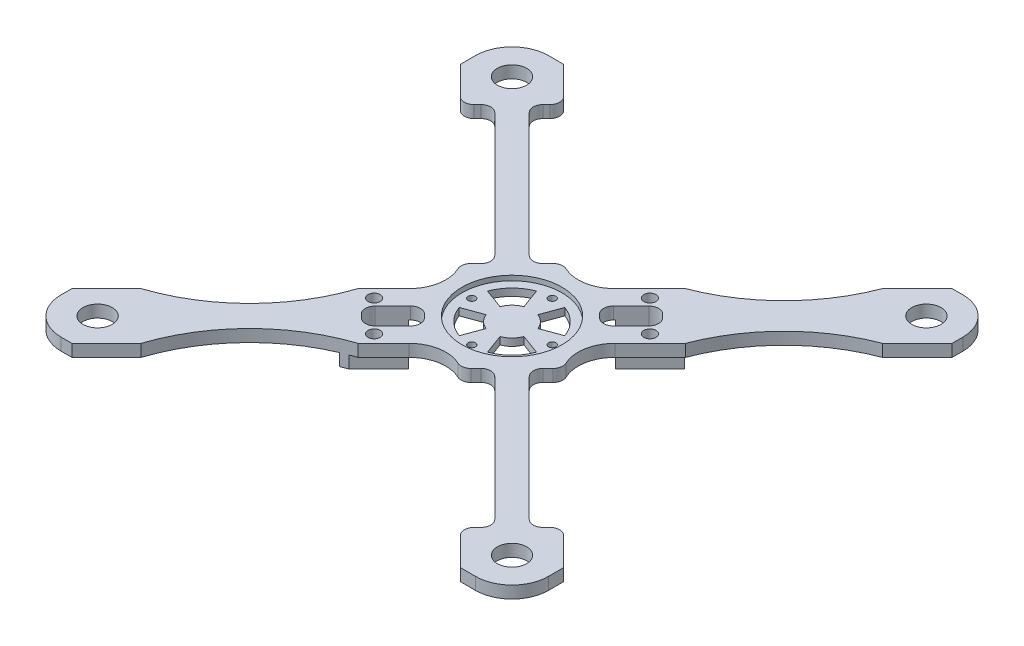
from build123d import *

# Parameters (mm, degrees)
SKETCH_1_W          = 200
SKETCH_1_H          = 200
SKETCH_1_R          = 6
EXTRUDE_1_DEPTH     = 5
SKETCH_3_R          = 20.5
CUT_EXTRUDE_1_DEPTH = 2
SKETCH_4_R          = 1.5
CUT_EXTRUDE_2_DEPTH = 142.453172464
SKETCH_6_R          = 2.5
EXTRUDE_2_DEPTH     = 5
CUT_EXTRUDE_3_DEPTH = 142.774468788
FILLET_1_R          = 15
SKETCH_7_R          = 2.5
CUT_EXTRUDE_4_DEPTH = 142.774468788
FILLET_2_R          = 4


with BuildPart() as part:
    # 草圖1 → 填料-伸長1 (new body)
    with BuildSketch(Plane(origin=(0, 0, 0), x_dir=(1, 0, 0), z_dir=(0, 1, 0))):
        Rectangle(SKETCH_1_W, SKETCH_1_H)
        with Locations(Location((85, 85, 0), (0, 0, 270))):
            Circle(SKETCH_1_R, mode=Mode.SUBTRACT)
        with Locations(Location((-85, 85, 0), (0, 0, 90))):
            Circle(SKETCH_1_R, mode=Mode.SUBTRACT)
        with Locations(Location((85, -85, 0), (0, 0, 90))):
            Circle(SKETCH_1_R, mode=Mode.SUBTRACT)
        with Locations(Location((-85, -85, 0), (0, 0, 270))):
            Circle(SKETCH_1_R, mode=Mode.SUBTRACT)
    extrude(amount=EXTRUDE_1_DEPTH)

    # 草圖3 → 除料-伸長1 (cut)
    with BuildSketch(Plane(origin=(0, 5, 0), x_dir=(1, 0, 0), z_dir=(0, 1, 0))):
        with Locations(Location((0, 0, 0), (0, 0, 270))):
            Circle(SKETCH_3_R)
    extrude(amount=-CUT_EXTRUDE_1_DEPTH, mode=Mode.SUBTRACT)

    # 草圖4 → 除料-伸長2 (cut, through all)
    with BuildSketch(Plane(origin=(0, 3, 0), x_dir=(1, 0, 0), z_dir=(0, 1, 0))):
        with Locations(Location((-16.5, 0, 0), (0, 0, 270))):
            Circle(SKETCH_4_R)
        with Locations(Location((16.5, 0, 0), (0, 0, 90))):
            Circle(SKETCH_4_R)
        with Locations(Location((0, 16.5, 0), (0, 0, 270))):
            Circle(SKETCH_4_R)
        with Locations(Location((0, -16.5, 0), (0, 0, 90))):
            Circle(SKETCH_4_R)
    extrude(amount=-CUT_EXTRUDE_2_DEPTH, mode=Mode.SUBTRACT)

    # 草圖6 → 填料-伸長2 (add)
    # profile 1 of 2: a face of its own
    with BuildSketch(Plane.XZ):
        Polygon((-44.194173824, 26.516504294), (-30.0520382, 12.374368671), (-12.374368671, 30.0520382), (-26.516504294, 44.194173824), align=None)
        with Locations(Location((-21.920310217, 34.648232278, 0), (0, 0, 270))):
            Circle(SKETCH_6_R, mode=Mode.SUBTRACT)
        with Locations(Location((-34.648232278, 21.920310217, 0), (0, 0, 90))):
            Circle(SKETCH_6_R, mode=Mode.SUBTRACT)
    # profile 2 of 2: a face of its own
    with BuildSketch(Plane.XZ):
        Polygon((26.516504294, -44.194173824), (44.194173824, -26.516504294), (30.0520382, -12.374368671), (12.374368671, -30.0520382), align=None)
        with Locations(Location((34.648232278, -21.920310217, 0), (0, 0, 90))):
            Circle(SKETCH_6_R, mode=Mode.SUBTRACT)
        with Locations(Location((21.920310217, -34.648232278, 0), (0, 0, 270))):
            Circle(SKETCH_6_R, mode=Mode.SUBTRACT)
    extrude(amount=EXTRUDE_2_DEPTH)

    # 草圖5 → 除料-伸長3 (cut, through all)
    with BuildSketch(Plane(origin=(0, 5, 0), x_dir=(1, 0, 0), z_dir=(0, 1, 0))):
        with BuildLine():
            Line((15.10230502, -22.173372832), (71.580921309, -78.651989121))
            Line((71.580921309, -78.651989121), (64.509853497, -85.723056933))
            Line((64.509853497, -85.723056933), (78.786796564, -100))
            Line((78.786796564, -100), (-80.554563517, -100))
            Line((-80.554563517, -100), (-66.36249332, -85.807929803))
            ThreePointArc((-66.36249332, -85.807929803), (-49.396614756, -58.27912998), (-21.867814933, -41.313251416))
            Line((-21.867814933, -41.313251416), (-0.883883476, -20.329319959))
            Line((-0.883883476, -20.329319959), (8.031237208, -29.244440644))
            Line((8.031237208, -29.244440644), (15.10230502, -22.173372832))
        make_face()
        with BuildLine():
            Line((-20.329319959, -0.883883476), (-29.244440644, 8.031237208))
            Line((-29.244440644, 8.031237208), (-22.173372832, 15.10230502))
            Line((-22.173372832, 15.10230502), (-78.651989121, 71.580921309))
            Line((-78.651989121, 71.580921309), (-85.723056933, 64.509853497))
            Line((-85.723056933, 64.509853497), (-100, 78.786796564))
            Line((-100, 78.786796564), (-100, -80.554563517))
            Line((-100, -80.554563517), (-85.807929803, -66.36249332))
            ThreePointArc((-85.807929803, -66.36249332), (-58.27912998, -49.396614756), (-41.313251416, -21.867814933))
            Line((-41.313251416, -21.867814933), (-20.329319959, -0.883883476))
        make_face()
        with BuildLine():
            Line((-78.786796564, 100), (80.554563517, 100))
            Line((80.554563517, 100), (66.27762045, 85.723056933))
            ThreePointArc((66.27762045, 85.723056933), (50.38135816, 61.198751144), (25.857052371, 45.302488854))
            Line((25.857052371, 45.302488854), (0.883883476, 20.329319959))
            Line((0.883883476, 20.329319959), (-8.031237208, 29.244440644))
            Line((-8.031237208, 29.244440644), (-15.10230502, 22.173372832))
            Line((-15.10230502, 22.173372832), (-71.580921309, 78.651989121))
            Line((-71.580921309, 78.651989121), (-64.509853497, 85.723056933))
            Line((-64.509853497, 85.723056933), (-78.786796564, 100))
        make_face()
        Polygon((14.425484168, 21.49655198), (27.355374186, 34.426441998), (34.426441998, 27.355374186), (21.49655198, 14.425484168), align=None)
        Polygon((-14.425484168, -21.49655198), (-27.355374186, -34.426441998), (-34.426441998, -27.355374186), (-21.49655198, -14.425484168), align=None)
        with BuildLine():
            Line((-15.866234687, 5.81423348), (-7.751406526, 2.840528218))
            ThreePointArc((-7.751406526, 2.840528218), (-5.837503906, 5.837503906), (-2.840528218, 7.751406526))
            Line((-2.840528218, 7.751406526), (-5.81423348, 15.866234687))
            ThreePointArc((-5.81423348, 15.866234687), (-11.948696877, 11.948696877), (-15.866234687, 5.81423348))
        make_face()
        with BuildLine():
            Line((15.866234687, 5.81423348), (7.751406526, 2.840528218))
            ThreePointArc((7.751406526, 2.840528218), (5.837503906, 5.837503906), (2.840528218, 7.751406526))
            Line((2.840528218, 7.751406526), (5.81423348, 15.866234687))
            ThreePointArc((5.81423348, 15.866234687), (11.948696877, 11.948696877), (15.866234687, 5.81423348))
        make_face()
        with BuildLine():
            Line((5.81423348, -15.866234687), (2.840528218, -7.751406526))
            ThreePointArc((2.840528218, -7.751406526), (5.837503906, -5.837503906), (7.751406526, -2.840528218))
            Line((7.751406526, -2.840528218), (15.866234687, -5.81423348))
            ThreePointArc((15.866234687, -5.81423348), (11.948696877, -11.948696877), (5.81423348, -15.866234687))
        make_face()
        with BuildLine():
            Line((-15.866234687, -5.81423348), (-7.751406526, -2.840528218))
            ThreePointArc((-7.751406526, -2.840528218), (-5.837503906, -5.837503906), (-2.840528218, -7.751406526))
            Line((-2.840528218, -7.751406526), (-5.81423348, -15.866234687))
            ThreePointArc((-5.81423348, -15.866234687), (-11.948696877, -11.948696877), (-15.866234687, -5.81423348))
        make_face()
        with BuildLine():
            Line((20.329319959, 0.883883476), (45.302488854, 25.857052371))
            ThreePointArc((45.302488854, 25.857052371), (61.198751144, 50.38135816), (85.723056933, 66.27762045))
            Line((85.723056933, 66.27762045), (100, 80.554563517))
            Line((100, 80.554563517), (100, -78.786796564))
            Line((100, -78.786796564), (85.723056933, -64.509853497))
            Line((85.723056933, -64.509853497), (78.651989121, -71.580921309))
            Line((78.651989121, -71.580921309), (22.173372832, -15.10230502))
            Line((22.173372832, -15.10230502), (29.244440644, -8.031237208))
            Line((29.244440644, -8.031237208), (20.329319959, 0.883883476))
        make_face()
    extrude(amount=-CUT_EXTRUDE_3_DEPTH, mode=Mode.SUBTRACT)

    # 圓角1
    # the kernel refuses this fillet: 15 mm, written as the material it adds along each edge
    with BuildSketch(Plane(origin=(-20.329319959, 40.020077646, 0.883883476), x_dir=(-0.7071067811865923, 0, -0.7071067811865027), z_dir=(0, -1, 0))) as fillet_1_piece_1_section:
        with BuildLine():
            CenterArc((15, -14.808031059), FILLET_1_R, 99.17638759, 80.82361241)
            Line((0, -14.808031059), (0, 0))
            Line((0, 0), (12.607884583, 0))
        make_face()
    fillet_1_piece_1 = extrude(amount=40.020077646, mode=Mode.PRIVATE)
    fillet_1_piece_1 = split(fillet_1_piece_1, bisect_by=Plane(origin=(-20.329319959, 5, 0.883883476), z_dir=(0, -1, 0)), keep=Keep.TOP, mode=Mode.PRIVATE)
    fillet_1_piece_1 = fillet_1_piece_1 - Plane(origin=(0, 40.020077646, 0), x_dir=(0, 0, 1), z_dir=(0, 1, 0)) * Cylinder(20.5, 140, mode=Mode.PRIVATE)
    add(fillet_1_piece_1)
    with BuildSketch(Plane(origin=(-20.329319959, 3, 0.883883476), x_dir=(-0.7071067811865923, 0, -0.7071067811865027), z_dir=(0, -1, 0)), Plane(origin=(20.329319959, 3, -0.883883476), x_dir=(0.7071067811865909, 0, 0.7071067811865042), z_dir=(0, -1, 0))) as fillet_1_piece_2:
        with BuildLine():
            CenterArc((15, -14.808031059), FILLET_1_R, 99.17638759, 80.82361241)
            Line((0, -14.808031059), (0, 0))
            Line((0, 0), (12.607884583, 0))
        make_face()
    extrude(amount=3)
    with BuildSketch(Plane(origin=(0.883883476, 40.020077646, -20.329319959), x_dir=(0.7071067811865474, 0, -0.7071067811865478), z_dir=(0, -1, 0))) as fillet_1_piece_3_section:
        with BuildLine():
            CenterArc((14.808031059, -15), FILLET_1_R, 90, 80.82361241)
            Line((0, -12.607884583), (0, 0))
            Line((0, 0), (14.808031059, 0))
        make_face()
    fillet_1_piece_3 = extrude(amount=40.020077646, mode=Mode.PRIVATE)
    fillet_1_piece_3 = split(fillet_1_piece_3, bisect_by=Plane(origin=(0.883883476, 5, -20.329319959), z_dir=(0, -1, 0)), keep=Keep.TOP, mode=Mode.PRIVATE)
    fillet_1_piece_3 = fillet_1_piece_3 - Plane(origin=(0, 40.020077646, 0), x_dir=(0, 0, 1), z_dir=(0, 1, 0)) * Cylinder(20.5, 140, mode=Mode.PRIVATE)
    add(fillet_1_piece_3)
    with BuildSketch(Plane(origin=(0.883883476, 3, -20.329319959), x_dir=(0.7071067811865474, 0, -0.7071067811865478), z_dir=(0, -1, 0)), Plane(origin=(-0.883883476, 3, 20.329319959), x_dir=(-0.7071067811865483, 0, 0.7071067811865467), z_dir=(0, -1, 0))) as fillet_1_piece_4:
        with BuildLine():
            CenterArc((14.808031059, -15), FILLET_1_R, 90, 80.82361241)
            Line((0, -12.607884583), (0, 0))
            Line((0, 0), (14.808031059, 0))
        make_face()
    extrude(amount=3)
    with BuildSketch(Plane(origin=(20.329319959, 40.020077646, -0.883883476), x_dir=(0.7071067811865909, 0, 0.7071067811865042), z_dir=(0, -1, 0))) as fillet_1_piece_5_section:
        with BuildLine():
            CenterArc((15, -14.808031059), FILLET_1_R, 99.17638759, 80.82361241)
            Line((0, -14.808031059), (0, 0))
            Line((0, 0), (12.607884583, 0))
        make_face()
    fillet_1_piece_5 = extrude(amount=40.020077646, mode=Mode.PRIVATE)
    fillet_1_piece_5 = split(fillet_1_piece_5, bisect_by=Plane(origin=(20.329319959, 5, -0.883883476), z_dir=(0, -1, 0)), keep=Keep.TOP, mode=Mode.PRIVATE)
    fillet_1_piece_5 = fillet_1_piece_5 - Plane(origin=(0, 40.020077646, 0), x_dir=(0, 0, 1), z_dir=(0, 1, 0)) * Cylinder(20.5, 140, mode=Mode.PRIVATE)
    add(fillet_1_piece_5)
    with BuildSketch(Plane(origin=(-0.883883476, 40.020077646, 20.329319959), x_dir=(-0.7071067811865483, 0, 0.7071067811865467), z_dir=(0, -1, 0))) as fillet_1_piece_6_section:
        with BuildLine():
            CenterArc((14.808031059, -15), FILLET_1_R, 90, 80.82361241)
            Line((0, -12.607884583), (0, 0))
            Line((0, 0), (14.808031059, 0))
        make_face()
    fillet_1_piece_6 = extrude(amount=40.020077646, mode=Mode.PRIVATE)
    fillet_1_piece_6 = split(fillet_1_piece_6, bisect_by=Plane(origin=(-0.883883476, 5, 20.329319959), z_dir=(0, -1, 0)), keep=Keep.TOP, mode=Mode.PRIVATE)
    fillet_1_piece_6 = fillet_1_piece_6 - Plane(origin=(0, 40.020077646, 0), x_dir=(0, 0, 1), z_dir=(0, 1, 0)) * Cylinder(20.5, 140, mode=Mode.PRIVATE)
    add(fillet_1_piece_6)
    # the kernel refuses this fillet: 15 mm, written as the material it takes off along each edge
    with BuildSketch(Plane(origin=(-100, -37.5, 100), x_dir=(1, 0, 0), z_dir=(0, 1, 0))) as fillet_1_2_piece_1:
        with BuildLine():
            CenterArc((FILLET_1_R, FILLET_1_R), FILLET_1_R, 180, 90)
            Line((0, FILLET_1_R), (0, 0))
            Line((0, 0), (FILLET_1_R, 0))
        make_face()
    extrude(amount=80, mode=Mode.SUBTRACT)
    with BuildSketch(Plane(origin=(-100, -37.5, -100), x_dir=(1, 0, 0), z_dir=(0, 1, 0)), Plane(origin=(100, -37.5, -100), x_dir=(0, 0, 1), z_dir=(0, 1, 0)), Plane(origin=(100, -37.5, 100), x_dir=(-1, 0, 0), z_dir=(0, 1, 0))) as fillet_1_2_piece_2:
        with BuildLine():
            CenterArc((FILLET_1_R, -FILLET_1_R), FILLET_1_R, 90, 90)
            Line((0, -FILLET_1_R), (0, 0))
            Line((0, 0), (FILLET_1_R, 0))
        make_face()
    extrude(amount=80, mode=Mode.SUBTRACT)

    # 草圖7 → 除料-伸長4 (cut, through all)
    with BuildSketch(Plane(origin=(0, 5, 0), x_dir=(1, 0, 0), z_dir=(0, 1, 0))):
        with Locations(Location((21.920310217, 34.648232278, 0), (0, 0, 270))):
            Circle(SKETCH_7_R)
        with Locations(Location((34.648232278, 21.920310217, 0), (0, 0, 270))):
            Circle(SKETCH_7_R)
        with Locations(Location((-21.920310217, -34.648232278, 0), (0, 0, 270))):
            Circle(SKETCH_7_R)
        with Locations(Location((-34.648232278, -21.920310217, 0), (0, 0, 270))):
            Circle(SKETCH_7_R)
    extrude(amount=-CUT_EXTRUDE_4_DEPTH, mode=Mode.SUBTRACT)

    # 圓角2
    fillet_2_edges = [part.edges().sort_by_distance(p)[0] for p in [
        (27.355374186, 0, -34.426441998),
        (34.426441998, 0, -27.355374186),
        (21.49655198, 2.5, -14.425484168),
        (14.425484168, 2.5, -21.49655198),
        (-27.355374186, 0, 34.426441998),
        (-34.426441998, 0, 27.355374186),
        (-21.49655198, 2.5, 14.425484168),
        (-14.425484168, 2.5, 21.49655198),
        (-8.031237208, 2.5, -29.244440644),
        (-15.10230502, 2.5, -22.173372832),
        (-71.580921309, 2.5, -78.651989121),
        (-64.509853497, 2.5, -85.723056933),
        (-29.244440644, 2.5, -8.031237208),
        (-85.723056933, 2.5, -64.509853497),
        (-78.651989121, 2.5, -71.580921309),
        (-22.173372832, 2.5, -15.10230502),
        (29.244440644, 2.5, 8.031237208),
        (85.723056933, 2.5, 64.509853497),
        (78.651989121, 2.5, 71.580921309),
        (22.173372832, 2.5, 15.10230502),
        (8.031237208, 2.5, 29.244440644),
        (15.10230502, 2.5, 22.173372832),
        (71.580921309, 2.5, 78.651989121),
        (64.509853497, 2.5, 85.723056933),
    ]]
    fillet(fillet_2_edges, radius=FILLET_2_R)


solid = part.part
